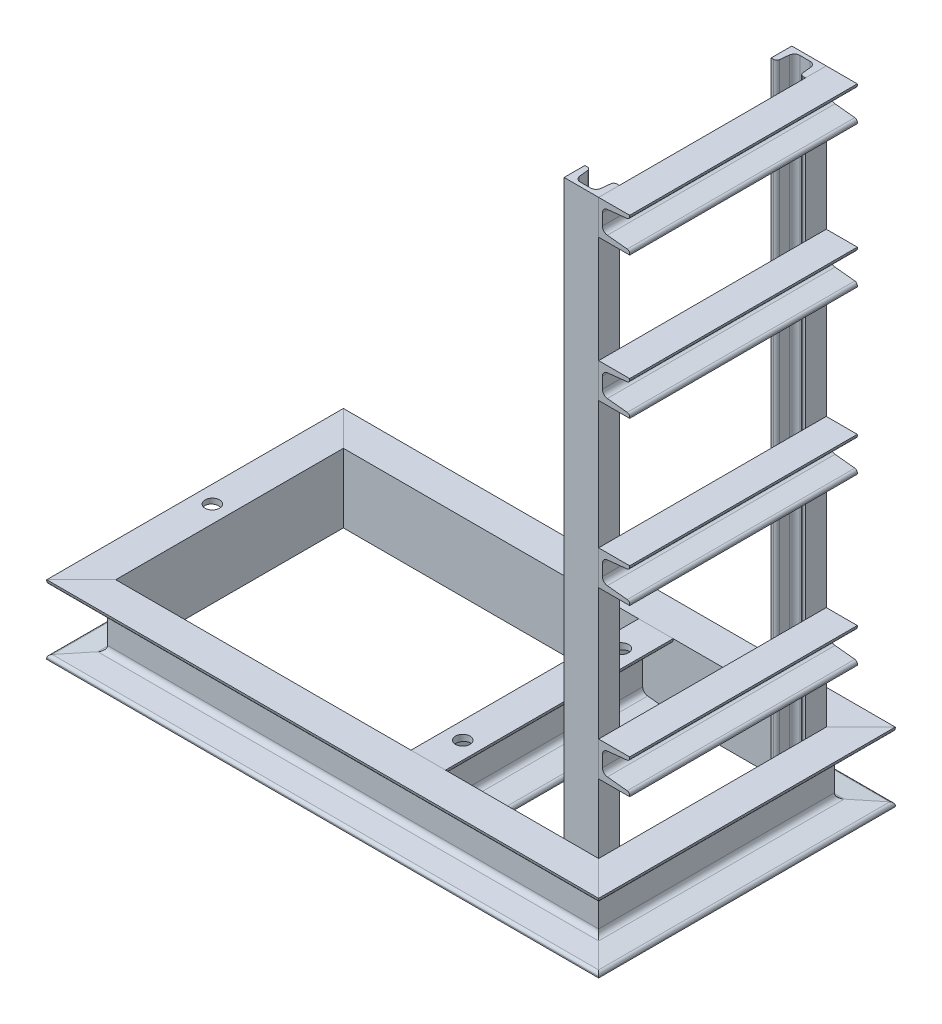
from build123d import *

# Parameters (mm, degrees)
MEMBER_1_DEPTH      = 442.803398875
MEMBER_1_DEPTH_BACK = 112.803398875
MEMBER_1_2_DEPTH    = 925.60679775
MEMBER_1_3_DEPTH    = 555.60679775
MEMBER_1_4_DEPTH    = 925.60679775
MEMBER_2_DEPTH      = 330
SKETCH_4_R          = 10.5
CUT_EXTRUDE_1_DEPTH = 10
MEMBER_START        = -100
MEMBER_3_DEPTH      = 930
MEMBER_5_DEPTH      = 330
MEMBER_5_2_DEPTH    = 330
MEMBER_5_3_DEPTH    = 330
MEMBER_5_4_DEPTH    = 330


# Read off the part's stored shape, not the designer's step: Конструкция3
with BuildPart() as part:
    # Sketch1 → Member 1 (new, two sides: drawn at the far end of the back side and taken through both)
    with BuildSketch(Plane(origin=(25, 0, -165), x_dir=(-1, 0, 0), z_dir=(0, 0, 1)).offset(-MEMBER_1_DEPTH_BACK)):
        with BuildLine():
            Line((50, 100), (0, 100))
            Line((0, 100), (0, 0))
            Line((0, 0), (50, 0))
            Line((50, 0), (50, 1.629852671))
            ThreePointArc((50, 1.629852671), (48.844151715, 4.6409404), (45.970378085, 6.1052012))
            Line((45.970378085, 6.1052012), (13.063772294, 9.563824837))
            ThreePointArc((13.063772294, 9.563824837), (7.954841396, 12.166955149), (5.9, 17.52))
            Line((5.9, 17.52), (5.9, 82.48))
            ThreePointArc((5.9, 82.48), (7.954841396, 87.833044851), (13.063772294, 90.436175163))
            Line((13.063772294, 90.436175163), (45.970378085, 93.8947988))
            ThreePointArc((45.970378085, 93.8947988), (48.844151715, 95.3590596), (50, 98.370147329))
            Line((50, 98.370147329), (50, 100))
        make_face()
    extrude(amount=MEMBER_1_DEPTH + MEMBER_1_DEPTH_BACK)

    # Member 1 mitre 1
    split(bisect_by=Plane(origin=(25, 0, -165), x_dir=(0, -1, 0), z_dir=(-0.707106781, 0, 0.707106781)), keep=Keep.TOP)

    # Member 1 mitre 2
    split(bisect_by=Plane(origin=(25, 0, 165), x_dir=(0, -1, 0), z_dir=(-0.707106781, 0, -0.707106781)), keep=Keep.TOP)


with BuildPart() as body_2:
    # Sketch1 on segment 2 (carried to segment 2) → Member 1 2 (new body)
    with BuildSketch(Plane(origin=(-87.803398875, 0, 165), x_dir=(0, 0, 1), z_dir=(1, 0, 0))):
        with BuildLine():
            Line((50, 100), (0, 100))
            Line((0, 100), (0, 0))
            Line((0, 0), (50, 0))
            Line((50, 0), (50, 1.629852671))
            ThreePointArc((50, 1.629852671), (48.844151715, 4.6409404), (45.970378085, 6.1052012))
            Line((45.970378085, 6.1052012), (13.063772294, 9.563824837))
            ThreePointArc((13.063772294, 9.563824837), (7.954841396, 12.166955149), (5.9, 17.52))
            Line((5.9, 17.52), (5.9, 82.48))
            ThreePointArc((5.9, 82.48), (7.954841396, 87.833044851), (13.063772294, 90.436175163))
            Line((13.063772294, 90.436175163), (45.970378085, 93.8947988))
            ThreePointArc((45.970378085, 93.8947988), (48.844151715, 95.3590596), (50, 98.370147329))
            Line((50, 98.370147329), (50, 100))
        make_face()
    extrude(amount=MEMBER_1_2_DEPTH)

    # Member 1 2 mitre 1
    split(bisect_by=Plane(origin=(25, 0, 165), x_dir=(0, 1, 0), z_dir=(0.707106781, 0, 0.707106781)), keep=Keep.TOP)

    # Member 1 2 mitre 2
    split(bisect_by=Plane(origin=(725, 0, 165), x_dir=(0, -1, 0), z_dir=(-0.707106781, 0, 0.707106781)), keep=Keep.TOP)


with BuildPart() as body_3:
    # Sketch1 on segment 3 (carried to segment 3) → Member 1 3 (new body)
    with BuildSketch(Plane(origin=(725, 0, 277.803398875), x_dir=(1, 0, 0), z_dir=(0, 0, -1))):
        with BuildLine():
            Line((50, 100), (0, 100))
            Line((0, 100), (0, 0))
            Line((0, 0), (50, 0))
            Line((50, 0), (50, 1.629852671))
            ThreePointArc((50, 1.629852671), (48.844151715, 4.6409404), (45.970378085, 6.1052012))
            Line((45.970378085, 6.1052012), (13.063772294, 9.563824837))
            ThreePointArc((13.063772294, 9.563824837), (7.954841396, 12.166955149), (5.9, 17.52))
            Line((5.9, 17.52), (5.9, 82.48))
            ThreePointArc((5.9, 82.48), (7.954841396, 87.833044851), (13.063772294, 90.436175163))
            Line((13.063772294, 90.436175163), (45.970378085, 93.8947988))
            ThreePointArc((45.970378085, 93.8947988), (48.844151715, 95.3590596), (50, 98.370147329))
            Line((50, 98.370147329), (50, 100))
        make_face()
    extrude(amount=MEMBER_1_3_DEPTH)

    # Member 1 3 mitre 1
    split(bisect_by=Plane(origin=(725, 0, 165), x_dir=(0, 1, 0), z_dir=(0.707106781, 0, -0.707106781)), keep=Keep.TOP)

    # Member 1 3 mitre 2
    split(bisect_by=Plane(origin=(725, 0, -165), x_dir=(0, 1, 0), z_dir=(0.707106781, 0, 0.707106781)), keep=Keep.TOP)


with BuildPart() as body_4:
    # Sketch1 on segment 4 (carried to segment 4) → Member 1 4 (new body)
    with BuildSketch(Plane(origin=(837.803398875, 0, -165), x_dir=(0, 0, -1), z_dir=(-1, 0, 0))):
        with BuildLine():
            Line((50, 100), (0, 100))
            Line((0, 100), (0, 0))
            Line((0, 0), (50, 0))
            Line((50, 0), (50, 1.629852671))
            ThreePointArc((50, 1.629852671), (48.844151715, 4.6409404), (45.970378085, 6.1052012))
            Line((45.970378085, 6.1052012), (13.063772294, 9.563824837))
            ThreePointArc((13.063772294, 9.563824837), (7.954841396, 12.166955149), (5.9, 17.52))
            Line((5.9, 17.52), (5.9, 82.48))
            ThreePointArc((5.9, 82.48), (7.954841396, 87.833044851), (13.063772294, 90.436175163))
            Line((13.063772294, 90.436175163), (45.970378085, 93.8947988))
            ThreePointArc((45.970378085, 93.8947988), (48.844151715, 95.3590596), (50, 98.370147329))
            Line((50, 98.370147329), (50, 100))
        make_face()
    extrude(amount=MEMBER_1_4_DEPTH)

    # Member 1 4 mitre 1
    split(bisect_by=Plane(origin=(25, 0, -165), x_dir=(0, 1, 0), z_dir=(0.707106781, 0, -0.707106781)), keep=Keep.TOP)

    # Member 1 4 mitre 2
    split(bisect_by=Plane(origin=(725, 0, -165), x_dir=(0, -1, 0), z_dir=(-0.707106781, 0, -0.707106781)), keep=Keep.TOP)


with BuildPart() as part_1:
    add(part.part)

    # Member 1 as one body: union body 2, body 3, body 4
    add(body_2.part)
    add(body_3.part)
    add(body_4.part)


with BuildPart() as body_2_2:
    # Sketch11 → Member 2 (new body)
    with BuildSketch(Plane(origin=(453, 0, -165), x_dir=(1, 0, 0), z_dir=(0, 0, -1))):
        with BuildLine():
            Line((50, 100), (0, 100))
            Line((0, 100), (0, 0))
            Line((0, 0), (50, 0))
            Line((50, 0), (50, 1.629852671))
            ThreePointArc((50, 1.629852671), (48.844151715, 4.6409404), (45.970378085, 6.1052012))
            Line((45.970378085, 6.1052012), (13.063772294, 9.563824837))
            ThreePointArc((13.063772294, 9.563824837), (7.954841396, 12.166955149), (5.9, 17.52))
            Line((5.9, 17.52), (5.9, 82.48))
            ThreePointArc((5.9, 82.48), (7.954841396, 87.833044851), (13.063772294, 90.436175163))
            Line((13.063772294, 90.436175163), (45.970378085, 93.8947988))
            ThreePointArc((45.970378085, 93.8947988), (48.844151715, 95.3590596), (50, 98.370147329))
            Line((50, 98.370147329), (50, 100))
        make_face()
    extrude(amount=-MEMBER_2_DEPTH)


with BuildPart() as cut_extrude_1_tool:
    # Эскиз4 → Вырез-Вытянуть1 (new body)
    with BuildSketch(Plane(origin=(0, 0, 0), x_dir=(1, 0, 0), z_dir=(0, 1, 0))):
        with Locations(Location((0, 0, 0), (0, 0, 180))):
            Circle(SKETCH_4_R)
        with Locations(Location((478, -115, 0), (0, 0, 180))):
            Circle(SKETCH_4_R)
        with Locations(Location((478, 115, 0), (0, 0, 180))):
            Circle(SKETCH_4_R)
    extrude(amount=-CUT_EXTRUDE_1_DEPTH)


with BuildPart() as part_2:
    add(part_1.part)

    # Вырез-Вытянуть1: cut by cut_extrude_1_tool
    add(cut_extrude_1_tool.part, mode=Mode.SUBTRACT)


with BuildPart() as body_2_2_1:
    add(body_2_2.part)

    # Вырез-Вытянуть1: cut by cut_extrude_1_tool
    add(cut_extrude_1_tool.part, mode=Mode.SUBTRACT)


with BuildPart() as body_3_2:
    # Member 3 outline → Member 3 (new body)
    with BuildSketch(Plane(origin=(0, 0, 0), x_dir=(1, 0, 0), z_dir=(0, 1, 0)).offset(MEMBER_START)):
        with BuildLine():
            Line((684.563824837, -151.936227706), (683.207285906, -139.029621915))
            ThreePointArc((683.207285906, -139.029621915), (681.743025105, -136.155848285), (678.731937376, -135))
            Line((678.731937376, -135), (675, -135))
            Line((675, -135), (675, -165))
            Line((675, -165), (725, -165))
            Line((725, -165), (725, -135))
            Line((725, -135), (721.268062624, -135))
            ThreePointArc((721.268062624, -135), (718.256974895, -136.155848285), (716.792714094, -139.029621915))
            Line((716.792714094, -139.029621915), (715.436175163, -151.936227706))
            ThreePointArc((715.436175163, -151.936227706), (712.833044851, -157.045158604), (707.48, -159.1))
            Line((707.48, -159.1), (692.52, -159.1))
            ThreePointArc((692.52, -159.1), (687.166955149, -157.045158604), (684.563824837, -151.936227706))
        make_face()
        with BuildLine():
            Line((721.268062624, 135), (725, 135))
            Line((725, 135), (725, 165))
            Line((725, 165), (675, 165))
            Line((675, 165), (675, 135))
            Line((675, 135), (678.731937376, 135))
            ThreePointArc((678.731937376, 135), (681.743025105, 136.155848285), (683.207285906, 139.029621915))
            Line((683.207285906, 139.029621915), (684.563824837, 151.936227706))
            ThreePointArc((684.563824837, 151.936227706), (687.166955149, 157.045158604), (692.52, 159.1))
            Line((692.52, 159.1), (707.48, 159.1))
            ThreePointArc((707.48, 159.1), (712.833044851, 157.045158604), (715.436175163, 151.936227706))
            Line((715.436175163, 151.936227706), (716.792714094, 139.029621915))
            ThreePointArc((716.792714094, 139.029621915), (718.256974895, 136.155848285), (721.268062624, 135))
        make_face()
    extrude(amount=MEMBER_3_DEPTH)


with BuildPart() as body_4_2:
    # Sketch16 → Member 5 (new body)
    with BuildSketch(Plane(origin=(725, 830, -165), x_dir=(1, 0, 0), z_dir=(0, 0, -1))):
        with BuildLine():
            Line((45, 50), (0, 50))
            Line((0, 50), (0, 0))
            Line((0, 0), (45, 0))
            Line((45, 0), (45, 1.822575176))
            ThreePointArc((45, 1.822575176), (43.972579302, 4.499097602), (41.418113853, 5.800662758))
            Line((41.418113853, 5.800662758), (12.663772294, 8.822865838))
            ThreePointArc((12.663772294, 8.822865838), (7.554841396, 11.42599615), (5.5, 16.779041001))
            Line((5.5, 16.779041001), (5.5, 33.220958999))
            ThreePointArc((5.5, 33.220958999), (7.554841396, 38.57400385), (12.663772294, 41.177134162))
            Line((12.663772294, 41.177134162), (41.418113853, 44.199337242))
            ThreePointArc((41.418113853, 44.199337242), (43.972579302, 45.500902398), (45, 48.177424824))
            Line((45, 48.177424824), (45, 50))
        make_face()
    extrude(amount=-MEMBER_5_DEPTH)


with BuildPart() as body_5:
    # Sketch16 on segment 2 (carried to segment 2) → Member 5 2 (new body)
    with BuildSketch(Plane(origin=(725, 150, 165), x_dir=(1, 0, 0), z_dir=(0, 0, -1))):
        with BuildLine():
            Line((45, 50), (0, 50))
            Line((0, 50), (0, 0))
            Line((0, 0), (45, 0))
            Line((45, 0), (45, 1.822575176))
            ThreePointArc((45, 1.822575176), (43.972579302, 4.499097602), (41.418113853, 5.800662758))
            Line((41.418113853, 5.800662758), (12.663772294, 8.822865838))
            ThreePointArc((12.663772294, 8.822865838), (7.554841396, 11.42599615), (5.5, 16.779041001))
            Line((5.5, 16.779041001), (5.5, 33.220958999))
            ThreePointArc((5.5, 33.220958999), (7.554841396, 38.57400385), (12.663772294, 41.177134162))
            Line((12.663772294, 41.177134162), (41.418113853, 44.199337242))
            ThreePointArc((41.418113853, 44.199337242), (43.972579302, 45.500902398), (45, 48.177424824))
            Line((45, 48.177424824), (45, 50))
        make_face()
    extrude(amount=MEMBER_5_2_DEPTH)


with BuildPart() as body_6:
    # Sketch16 on segment 3 (carried to segment 3) → Member 5 3 (new body)
    with BuildSketch(Plane(origin=(725, 625, 165), x_dir=(1, 0, 0), z_dir=(0, 0, -1))):
        with BuildLine():
            Line((45, 50), (0, 50))
            Line((0, 50), (0, 0))
            Line((0, 0), (45, 0))
            Line((45, 0), (45, 1.822575176))
            ThreePointArc((45, 1.822575176), (43.972579302, 4.499097602), (41.418113853, 5.800662758))
            Line((41.418113853, 5.800662758), (12.663772294, 8.822865838))
            ThreePointArc((12.663772294, 8.822865838), (7.554841396, 11.42599615), (5.5, 16.779041001))
            Line((5.5, 16.779041001), (5.5, 33.220958999))
            ThreePointArc((5.5, 33.220958999), (7.554841396, 38.57400385), (12.663772294, 41.177134162))
            Line((12.663772294, 41.177134162), (41.418113853, 44.199337242))
            ThreePointArc((41.418113853, 44.199337242), (43.972579302, 45.500902398), (45, 48.177424824))
            Line((45, 48.177424824), (45, 50))
        make_face()
    extrude(amount=MEMBER_5_3_DEPTH)


with BuildPart() as body_7:
    # Sketch16 on segment 4 (carried to segment 4) → Member 5 4 (new body)
    with BuildSketch(Plane(origin=(725, 390, 165), x_dir=(1, 0, 0), z_dir=(0, 0, -1))):
        with BuildLine():
            Line((45, 50), (0, 50))
            Line((0, 50), (0, 0))
            Line((0, 0), (45, 0))
            Line((45, 0), (45, 1.822575176))
            ThreePointArc((45, 1.822575176), (43.972579302, 4.499097602), (41.418113853, 5.800662758))
            Line((41.418113853, 5.800662758), (12.663772294, 8.822865838))
            ThreePointArc((12.663772294, 8.822865838), (7.554841396, 11.42599615), (5.5, 16.779041001))
            Line((5.5, 16.779041001), (5.5, 33.220958999))
            ThreePointArc((5.5, 33.220958999), (7.554841396, 38.57400385), (12.663772294, 41.177134162))
            Line((12.663772294, 41.177134162), (41.418113853, 44.199337242))
            ThreePointArc((41.418113853, 44.199337242), (43.972579302, 45.500902398), (45, 48.177424824))
            Line((45, 48.177424824), (45, 50))
        make_face()
    extrude(amount=MEMBER_5_4_DEPTH)


solid = Compound([part_2.part, body_2_2_1.part, body_3_2.part, body_4_2.part, body_5.part, body_6.part, body_7.part])
